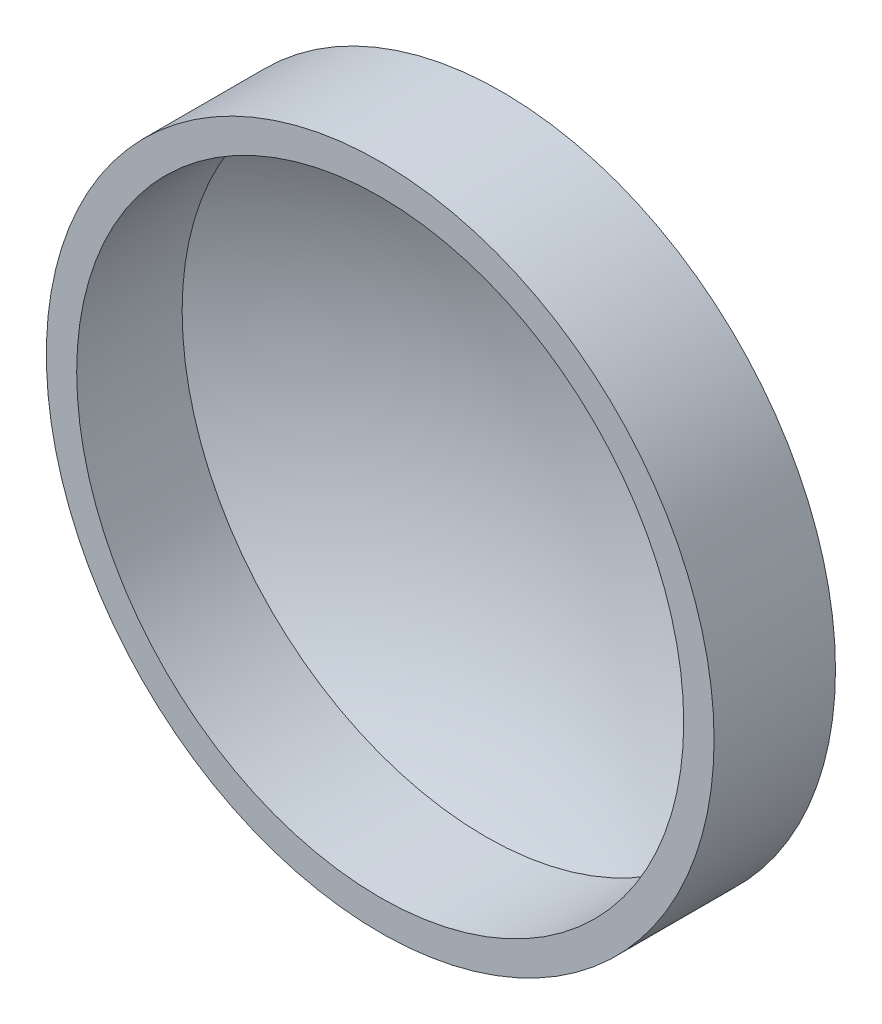
from build123d import *


# Read off the part's stored shape, not the designer's step: Shell4
with BuildPart() as part:
    # Sketch4 → Revolve1 (revolve)
    with BuildSketch(Plane(origin=(0, 0, 0), x_dir=(1, 0, 0), z_dir=(0, 1, 0))):
        with BuildLine():
            Line((0, 29.718), (0, 10.668))
            Line((0, 10.668), (27.94, 10.668))
            Line((27.94, 10.668), (27.94, 20.828))
            ThreePointArc((27.94, 20.828), (14.661474883, 27.446206777), (0, 29.718))
        make_face()
    revolve(axis=Axis((0, 0, 0), (0, 0, -1)))

    # Shell4 outline → Shell4 (revolve, cut)
    with BuildSketch(Plane.XZ):
        with BuildLine():
            add(Edge.make_bspline(
                [(0, -27.17799952), (13.865377396, -27.18675375), (25.4, -19.492519002)],
                knots=[4.711757607, 4.711757607, 4.711757607, 5.300660806, 5.300660806, 5.300660806], degree=2, weights=[1, 0.95696144, 1]))
            Line((25.4, -19.492519002), (25.4, -10.668))
            Line((25.4, -10.668), (0, -10.668))
            Line((0, -10.668), (0, -27.17799952))
        make_face()
    revolve(axis=Axis((0, 0, 0), (0, 0, 1)), mode=Mode.SUBTRACT)


solid = part.part
